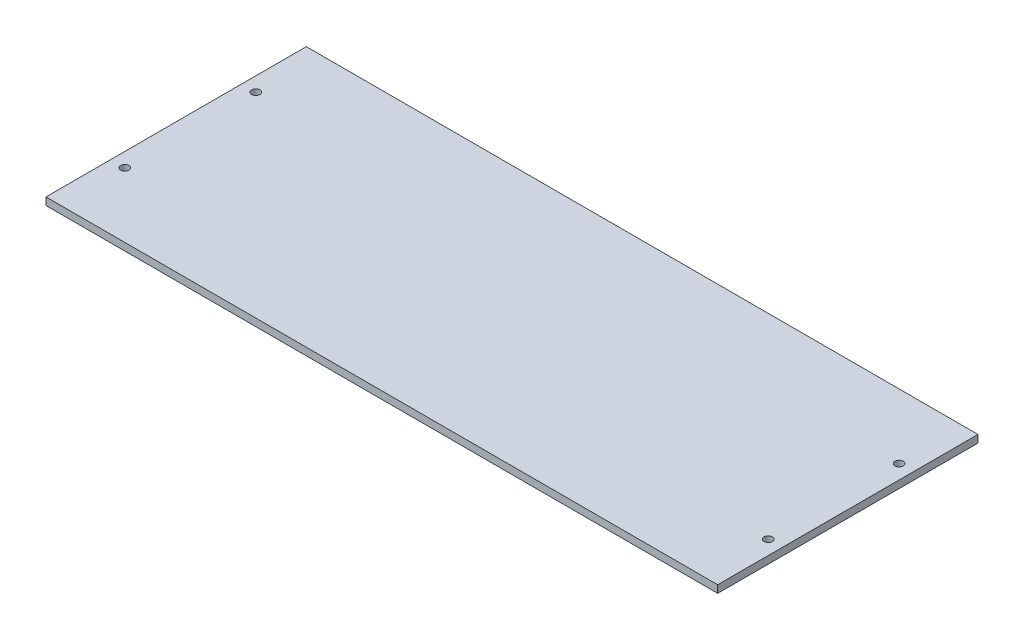
from build123d import *

# Parameters (mm, degrees)
SKETCH_1_W      = 179.6
SKETCH_1_H      = 69.6
SKETCH_1_R      = 1.1
EXTRUDE_1_DEPTH = 2


with BuildPart() as part:
    # 草图1 → 凸台-拉伸1 (new body)
    with BuildSketch(Plane(origin=(0, 0, 0), x_dir=(1, 0, 0), z_dir=(0, 1, 0))):
        Rectangle(SKETCH_1_W, SKETCH_1_H)
        with Locations((-86, 17.5)):
            Circle(SKETCH_1_R, mode=Mode.SUBTRACT)
        with Locations((-86, -17.5)):
            Circle(SKETCH_1_R, mode=Mode.SUBTRACT)
        with Locations((86, -17.5)):
            Circle(SKETCH_1_R, mode=Mode.SUBTRACT)
        with Locations((86, 17.5)):
            Circle(SKETCH_1_R, mode=Mode.SUBTRACT)
    extrude(amount=EXTRUDE_1_DEPTH)


solid = part.part
